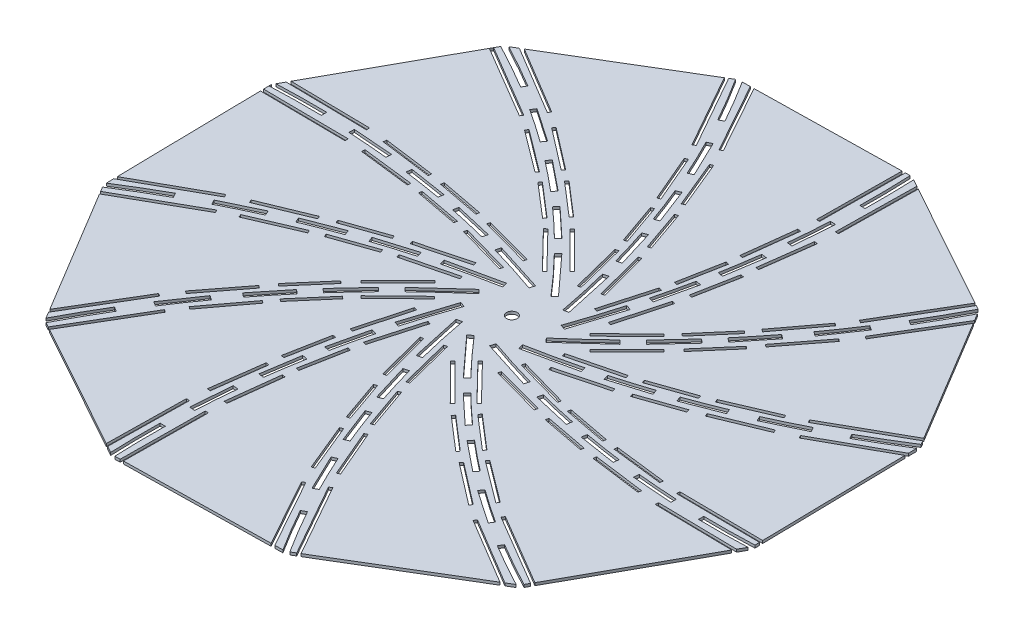
from build123d import *

# Parameters (mm, degrees)
BOSS_EXTRUDE2_DEPTH = 1.25
CUT_EXTRUDE1_DEPTH  = 10
CIRPATTERN3_DEPTH   = 1.25
CUT_EXTRUDE2_DEPTH  = 1.25
CIRPATTERN4_COUNT   = 12
SKETCH9_R           = 16.125
BOSS_EXTRUDE3_DEPTH = 1.25
BOSS_EXTRUDE4_DEPTH = 1.25
SKETCH13_R          = 2.5
CUT_EXTRUDE4_DEPTH  = 214.108875695


with BuildPart() as part:
    # Sketch2 → Boss-Extrude2 (new body)
    with BuildSketch(Plane(origin=(0, 0, 0), x_dir=(1, 0, 0), z_dir=(0, 1, 0))):
        with BuildLine():
            add(Edge.make_bspline(
                [(14.774632215, 2.590413659), (32.660535864, 51.583829136), (39.69013398, 100.241877456), (37.5, 150.695644658)],
                knots=[0, 0, 0, 0, 1, 1, 1, 1], degree=3))
            Line((37.5, 150.695644658), (107.823774971, 111.756256513))
            add(Edge.make_bspline(
                [(9.630680142, -11.5), (71.096415956, 41.392925852), (107.823774971, 111.756256513)],
                knots=[0, 0, 0, 1, 1, 1], degree=2))
            add(Edge.make_bspline(
                [(9.630680142, -11.5), (61.003174388, -2.492939191), (106.65707939, 15.748274422), (149.256256513, 42.871869687)],
                knots=[0, 0, 0, 0, 1, 1, 1, 1], degree=3))
            Line((149.256256513, 42.871869687), (150.695644658, -37.5))
            add(Edge.make_bspline(
                [(-5.143952072, -14.090413659), (71.395533302, -40.87483941), (150.695644658, -37.5)],
                knots=[0, 0, 0, 1, 1, 1], degree=2))
            add(Edge.make_bspline(
                [(-5.143952072, -14.090413659), (28.342638524, -54.076768327), (66.96694541, -84.493603035), (111.756256513, -107.823774971)],
                knots=[0, 0, 0, 0, 1, 1, 1, 1], degree=3))
            Line((111.756256513, -107.823774971), (42.871869687, -149.256256513))
            add(Edge.make_bspline(
                [(-14.774632215, -2.590413659), (0.299117346, -82.267765262), (42.871869687, -149.256256513)],
                knots=[0, 0, 0, 1, 1, 1], degree=2))
            add(Edge.make_bspline(
                [(-14.774632215, -2.590413659), (-32.660535864, -51.583829136), (-39.69013398, -100.241877456), (-37.5, -150.695644658)],
                knots=[0, 0, 0, 0, 1, 1, 1, 1], degree=3))
            Line((-37.5, -150.695644658), (-107.823774971, -111.756256513))
            add(Edge.make_bspline(
                [(-9.630680142, 11.5), (-71.096415956, -41.392925852), (-107.823774971, -111.756256513)],
                knots=[0, 0, 0, 1, 1, 1], degree=2))
            add(Edge.make_bspline(
                [(-9.630680142, 11.5), (-61.003174388, 2.492939191), (-106.65707939, -15.748274422), (-149.256256513, -42.871869687)],
                knots=[0, 0, 0, 0, 1, 1, 1, 1], degree=3))
            Line((-149.256256513, -42.871869687), (-150.695644658, 37.5))
            add(Edge.make_bspline(
                [(5.143952072, 14.090413659), (-71.395533302, 40.87483941), (-150.695644658, 37.5)],
                knots=[0, 0, 0, 1, 1, 1], degree=2))
            add(Edge.make_bspline(
                [(5.143952072, 14.090413659), (-28.342638524, 54.076768327), (-66.96694541, 84.493603035), (-111.756256513, 107.823774971)],
                knots=[0, 0, 0, 0, 1, 1, 1, 1], degree=3))
            Line((-111.756256513, 107.823774971), (-42.871869687, 149.256256513))
            add(Edge.make_bspline(
                [(14.774632215, 2.590413659), (-0.299117346, 82.267765262), (-42.871869687, 149.256256513)],
                knots=[0, 0, 0, 1, 1, 1], degree=2))
        make_face()
        with BuildLine():
            add(Edge.make_bspline(
                [(-5.143952072, -14.090413659), (71.395533302, -40.87483941), (150.695644658, -37.5)],
                knots=[0, 0, 0, 1, 1, 1], degree=2))
            Line((150.695644658, -37.5), (111.756256513, -107.823774971))
            add(Edge.make_bspline(
                [(-5.143952072, -14.090413659), (28.342638524, -54.076768327), (66.96694541, -84.493603035), (111.756256513, -107.823774971)],
                knots=[0, 0, 0, 0, 1, 1, 1, 1], degree=3))
        make_face()
        with BuildLine():
            add(Edge.make_bspline(
                [(-14.774632215, -2.590413659), (0.299117346, -82.267765262), (42.871869687, -149.256256513)],
                knots=[0, 0, 0, 1, 1, 1], degree=2))
            Line((42.871869687, -149.256256513), (-37.5, -150.695644658))
            add(Edge.make_bspline(
                [(-14.774632215, -2.590413659), (-32.660535864, -51.583829136), (-39.69013398, -100.241877456), (-37.5, -150.695644658)],
                knots=[0, 0, 0, 0, 1, 1, 1, 1], degree=3))
        make_face()
        with BuildLine():
            add(Edge.make_bspline(
                [(-9.630680142, 11.5), (-71.096415956, -41.392925852), (-107.823774971, -111.756256513)],
                knots=[0, 0, 0, 1, 1, 1], degree=2))
            Line((-107.823774971, -111.756256513), (-149.256256513, -42.871869687))
            add(Edge.make_bspline(
                [(-9.630680142, 11.5), (-61.003174388, 2.492939191), (-106.65707939, -15.748274422), (-149.256256513, -42.871869687)],
                knots=[0, 0, 0, 0, 1, 1, 1, 1], degree=3))
        make_face()
        with BuildLine():
            add(Edge.make_bspline(
                [(5.143952072, 14.090413659), (-71.395533302, 40.87483941), (-150.695644658, 37.5)],
                knots=[0, 0, 0, 1, 1, 1], degree=2))
            Line((-150.695644658, 37.5), (-111.756256513, 107.823774971))
            add(Edge.make_bspline(
                [(5.143952072, 14.090413659), (-28.342638524, 54.076768327), (-66.96694541, 84.493603035), (-111.756256513, 107.823774971)],
                knots=[0, 0, 0, 0, 1, 1, 1, 1], degree=3))
        make_face()
        with BuildLine():
            add(Edge.make_bspline(
                [(14.774632215, 2.590413659), (-0.299117346, 82.267765262), (-42.871869687, 149.256256513)],
                knots=[0, 0, 0, 1, 1, 1], degree=2))
            Line((-42.871869687, 149.256256513), (37.5, 150.695644658))
            add(Edge.make_bspline(
                [(14.774632215, 2.590413659), (32.660535864, 51.583829136), (39.69013398, 100.241877456), (37.5, 150.695644658)],
                knots=[0, 0, 0, 0, 1, 1, 1, 1], degree=3))
        make_face()
        with BuildLine():
            add(Edge.make_bspline(
                [(9.630680142, -11.5), (71.096415956, 41.392925852), (107.823774971, 111.756256513)],
                knots=[0, 0, 0, 1, 1, 1], degree=2))
            Line((107.823774971, 111.756256513), (149.256256513, 42.871869687))
            add(Edge.make_bspline(
                [(9.630680142, -11.5), (61.003174388, -2.492939191), (106.65707939, 15.748274422), (149.256256513, 42.871869687)],
                knots=[0, 0, 0, 0, 1, 1, 1, 1], degree=3))
        make_face()
    extrude(amount=BOSS_EXTRUDE2_DEPTH)

    # Sketch7 → Cut-Extrude1 (cut)
    with BuildSketch(Plane(origin=(0, 1.25, 0), x_dir=(1, 0, 0), z_dir=(0, 1, 0))):
        with BuildLine():
            add(Edge.make_bspline(
                [(-149.282481722, -41.407518955), (-149.228700939, -41.373413362), (-146.693873782, -39.766739974), (-141.381709294, -36.479286574), (-135.342424573, -32.928481348), (-131.09185765, -30.516169492), (-129.643105931, -29.705939951), (-128.938858403, -29.314905987)],
                knots=[-0.024102789, -0.024102789, -0.024102789, -0.024102789, -0.022844979, 0.035186849, 0.099507726, 0.116550339, 0.132630558, 0.132630558, 0.132630558, 0.132630558], degree=3))
            Line((-149.282481722, -41.407518955), (-149.256256513, -42.871869687))
            Line((-149.256256513, -42.871869687), (-148.612181694, -43.942688942))
            Line((-148.612181694, -43.942688942), (-148.584897413, -43.926278032))
            add(Edge.make_bspline(
                [(-148.584897413, -43.926278032), (-146.014006388, -42.28934952), (-140.93728059, -39.134741393), (-135.519091449, -35.93077168), (-132.077237941, -33.951986707), (-130.836208144, -33.245149502), (-129.593176427, -32.543854831), (-128.659834959, -32.020617091), (-128.036903141, -31.673621922), (-127.7252602, -31.500581947)],
                knots=[0.029007465, 0.029007465, 0.029007465, 0.029007465, 0.089694498, 0.147805056, 0.154966222, 0.169288553, 0.176449719, 0.183610885, 0.19077205, 0.19077205, 0.19077205, 0.19077205], degree=3))
            Line((-127.725260198, -31.50058195), (-128.938858403, -29.314905987))
        make_face()
        with BuildLine():
            Line((-11.053392377, 11.247936239), (-9.630680142, 11.5))
            add(Edge.make_bspline(
                [(-9.630680142, 11.5), (-10.105405181, 11.416767185), (-10.579641892, 11.332745837), (-11.053392376, 11.247936234)],
                knots=[0, 0, 0, 0, 0.009240841, 0.009240841, 0.009240841, 0.009240841], degree=3))
        make_face()
        with BuildLine():
            Line((-99.892572768, -14.748193021), (-117.065063259, -22.986708862))
            Line((-117.065063259, -22.986708862), (-115.927697313, -25.213005945))
            add(Edge.make_bspline(
                [(-115.927697313, -25.213005945), (-114.937296408, -24.707032026), (-112.027065207, -23.236248648), (-107.171906132, -20.860456384), (-102.467804444, -18.657451509), (-99.691802304, -17.398578089), (-98.868346085, -17.02875429)],
                knots=[0.280483128, 0.280483128, 0.280483128, 0.280483128, 0.302910897, 0.346262304, 0.389613711, 0.407854104, 0.407854104, 0.407854104, 0.407854104], degree=3))
            Line((-98.868346085, -17.02875429), (-99.892572768, -14.748193021))
        make_face()
        with BuildLine():
            Line((-38.501059144, 6.609925338), (-37.887193471, 4.186463159))
            add(Edge.make_bspline(
                [(-37.887193471, 4.186463159), (-37.180414885, 4.365490963), (-35.269718364, 4.843636439), (-30.352154167, 6.033876538), (-23.085593688, 7.663440839), (-16.931538829, 8.889415127), (-13.857159413, 9.464170353)],
                knots=[0.839804114, 0.839804114, 0.839804114, 0.839804114, 0.854186365, 0.878625933, 0.939312967, 1, 1, 1, 1], degree=3))
            Line((-13.857159413, 9.464170353), (-14.393713685, 11.907166411))
            Line((-14.393713685, 11.907166411), (-38.501059144, 6.609925338))
        make_face()
        with BuildLine():
            Line((-73.036719789, -3.919585165), (-89.87851656, -10.425078328))
            Line((-89.87851656, -10.425078328), (-88.921302479, -12.734567709))
            add(Edge.make_bspline(
                [(-88.921302479, -12.734567709), (-88.086830141, -12.388703961), (-86.415065458, -11.702974142), (-81.553962965, -9.750597285), (-76.812731203, -7.942684577), (-72.885202398, -6.521111908), (-72.192903694, -6.272875287)],
                knots=[0.480815674, 0.480815674, 0.480815674, 0.480815674, 0.499056067, 0.51729646, 0.586532476, 0.601322176, 0.601322176, 0.601322176, 0.601322176], degree=3))
            Line((-72.192903694, -6.272875287), (-73.036719789, -3.919585165))
        make_face()
        with BuildLine():
            Line((-64.724418608, -1.049643444), (-63.836814892, -3.389145732))
            add(Edge.make_bspline(
                [(-63.836814892, -3.389145732), (-63.136385097, -3.156766453), (-58.724063307, -1.707544494), (-53.581962331, -0.124972583), (-48.410000481, 1.361375644), (-47.015540641, 1.753394014), (-46.31726418, 1.947518211)],
                knots=[0.660480977, 0.660480977, 0.660480977, 0.660480977, 0.675270678, 0.753510604, 0.767892855, 0.782275107, 0.782275107, 0.782275107, 0.782275107], degree=3))
            Line((-46.31726418, 1.947518211), (-46.986880812, 4.356172102))
            Line((-46.986880812, 4.356172102), (-64.724418608, -1.049643444))
        make_face()
    extrude(amount=-CUT_EXTRUDE1_DEPTH, mode=Mode.SUBTRACT)

    # CirPattern3: read off the stored shape, not the designer's step
    # CirPattern3 outline → CirPattern3 (cut)
    with BuildSketch(Plane(origin=(0, 0, 0), x_dir=(1, 0, 0), z_dir=(0, 1, 0))):
        with BuildLine():
            add(Edge.make_bspline(
                [(-149.901339671, 38.934499302), (-149.859967869, 38.936213092), (-146.883678157, 39.059060746), (-140.661701424, 39.249317233), (-133.656124822, 39.304762402), (-128.768869958, 39.268602289), (-127.109099396, 39.245905795), (-126.303686163, 39.232427378)],
                knots=[-0.023662933, -0.023662933, -0.023662933, -0.023662933, -0.022844979, 0.035186849, 0.099507726, 0.116550339, 0.132630558, 0.132630558, 0.132630558, 0.132630558], degree=3))
            Line((-149.901339671, 38.934499302), (-150.675507762, 37.53636684))
            Line((-150.675507762, 37.53636684), (-150.655175387, 36.401057383))
            Line((-150.655175387, 36.401057383), (-150.623341053, 36.401627507))
            add(Edge.make_bspline(
                [(-150.623341053, 36.401627507), (-147.578419858, 36.533803671), (-141.604542285, 36.727411549), (-135.310267991, 36.793036143), (-131.340142931, 36.785787444), (-129.911960996, 36.777411521), (-128.484816617, 36.763234663), (-127.414900325, 36.749701104), (-126.701927961, 36.738741827), (-126.34551727, 36.732777371)],
                knots=[0.029007465, 0.029007465, 0.029007465, 0.029007465, 0.089694498, 0.147805056, 0.154966222, 0.169288553, 0.176449719, 0.183610885, 0.19077205, 0.19077205, 0.19077205, 0.19077205], degree=3))
            Line((-126.34551727, 36.732777371), (-126.303686163, 39.232427378))
        make_face()
        with BuildLine():
            add(Edge.make_bspline(
                [(-110.20897497, 108.75443164), (-107.611684073, 107.393881466), (-102.169300663, 104.469626713), (-96.079124524, 101.017436611), (-91.864717713, 98.542493603), (-90.438662489, 97.692952581), (-89.747893378, 97.278573313)],
                knots=[-0.022740828, -0.022740828, -0.022740828, -0.022740828, 0.035186849, 0.099507726, 0.116550339, 0.132630558, 0.132630558, 0.132630558, 0.132630558], degree=3))
            Line((-110.20897497, 108.75443164), (-111.756256513, 107.823774971))
            Line((-111.756256513, 107.823774971), (-112.220804569, 106.984810248))
            add(Edge.make_bspline(
                [(-112.220804569, 106.984810248), (-109.519057024, 105.577468339), (-104.250051688, 102.758872874), (-98.76751766, 99.669289448), (-95.332912851, 97.67794936), (-94.100258976, 96.956604631), (-92.871404117, 96.230754923), (-91.951596208, 95.684076371), (-91.339623667, 95.318099176), (-91.033945182, 95.13472846)],
                knots=[0.029036859, 0.029036859, 0.029036859, 0.029036859, 0.089694498, 0.147805056, 0.154966222, 0.169288553, 0.176449719, 0.183610885, 0.19077205, 0.19077205, 0.19077205, 0.19077205], degree=3))
            Line((-91.033945182, 95.13472846), (-89.747893378, 97.278573313))
        make_face()
        with BuildLine():
            add(Edge.make_bspline(
                [(-40.954471655, 149.290595393), (-39.417885171, 146.862665345), (-36.198827929, 141.658321039), (-32.680150564, 135.673680063), (-30.267838708, 131.42311314), (-29.457609167, 129.974361421), (-29.066575203, 129.270113893)],
                knots=[-0.021583724, -0.021583724, -0.021583724, -0.021583724, 0.035186849, 0.099507726, 0.116550339, 0.132630558, 0.132630558, 0.132630558, 0.132630558], degree=3))
            Line((-40.954471655, 149.290595393), (-42.871869687, 149.256256513))
            Line((-42.871869687, 149.256256513), (-43.611327618, 148.811488425))
            add(Edge.make_bspline(
                [(-43.611327618, 148.811488425), (-41.997292385, 146.274880981), (-38.865464717, 141.23311477), (-35.682440896, 135.850346939), (-33.703655923, 132.408493431), (-32.996818718, 131.167463634), (-32.295524047, 129.924431917), (-31.772286307, 128.991090449), (-31.425291138, 128.368158631), (-31.252251163, 128.05651569)],
                knots=[0.029830918, 0.029830918, 0.029830918, 0.029830918, 0.089694498, 0.147805056, 0.154966222, 0.169288553, 0.176449719, 0.183610885, 0.19077205, 0.19077205, 0.19077205, 0.19077205], degree=3))
            Line((-31.252251163, 128.05651569), (-29.066575203, 129.270113893))
        make_face()
        with BuildLine():
            add(Edge.make_bspline(
                [(39.20242207, 149.752986591), (39.315842557, 146.936887242), (39.498580056, 140.87519242), (39.553093186, 133.987380312), (39.516933073, 129.100125448), (39.494236579, 127.440354886), (39.480758162, 126.634941653)],
                knots=[-0.020501729, -0.020501729, -0.020501729, -0.020501729, 0.035186849, 0.099507726, 0.116550339, 0.132630558, 0.132630558, 0.132630558, 0.132630558], degree=3))
            Line((39.20242207, 149.752986591), (37.5, 150.695644658))
            Line((37.5, 150.695644658), (36.661760142, 150.680632533))
            add(Edge.make_bspline(
                [(36.661760142, 150.680632533), (36.788035651, 147.726645649), (36.976690537, 141.844852312), (37.041366927, 135.641523481), (37.034118228, 131.671398421), (37.025742305, 130.243216486), (37.011565447, 128.816072107), (36.998031888, 127.746155815), (36.987072611, 127.033183451), (36.981108155, 126.67677276)],
                knots=[0.030827433, 0.030827433, 0.030827433, 0.030827433, 0.089694498, 0.147805056, 0.154966222, 0.169288553, 0.176449719, 0.183610885, 0.19077205, 0.19077205, 0.19077205, 0.19077205], degree=3))
            Line((36.981108155, 126.67677276), (39.480758162, 126.634941653))
        make_face()
        with BuildLine():
            add(Edge.make_bspline(
                [(108.794271154, 110.142739003), (107.500723913, 107.67978486), (104.64469178, 102.371304545), (101.265767395, 96.410380014), (98.790824387, 92.195973203), (97.941283365, 90.769917979), (97.526904097, 90.079148868)],
                knots=[-0.019784656, -0.019784656, -0.019784656, -0.019784656, 0.035186849, 0.099507726, 0.116550339, 0.132630558, 0.132630558, 0.132630558, 0.132630558], degree=3))
            Line((108.794271154, 110.142739003), (107.823774971, 111.756256513))
            Line((107.823774971, 111.756256513), (107.043448438, 112.188335675))
            add(Edge.make_bspline(
                [(107.043448438, 112.188335675), (105.696527892, 109.608801637), (102.940408656, 104.462777972), (99.917620232, 99.09877315), (97.926280144, 95.664168341), (97.204935415, 94.431514466), (96.479085707, 93.202659607), (95.932407155, 92.282851698), (95.56642996, 91.670879157), (95.383059244, 91.365200672)],
                knots=[0.031759379, 0.031759379, 0.031759379, 0.031759379, 0.089694498, 0.147805056, 0.154966222, 0.169288553, 0.176449719, 0.183610885, 0.19077205, 0.19077205, 0.19077205, 0.19077205], degree=3))
            Line((95.383059244, 91.365200672), (97.526904097, 90.079148868))
        make_face()
        with BuildLine():
            Line((-107.823774971, -111.756256513), (-106.627309107, -112.418758615))
            add(Edge.make_bspline(
                [(-106.627309107, -112.418758615), (-105.228317252, -109.733937053), (-102.418367566, -104.481968465), (-99.338033958, -99.015848444), (-97.34669387, -95.581243635), (-96.625349141, -94.34858976), (-95.899499433, -93.119734901), (-95.352820881, -92.199926992), (-94.986843686, -91.587954451), (-94.80347297, -91.282275966)],
                knots=[0.029413875, 0.029413875, 0.029413875, 0.029413875, 0.089694498, 0.147805056, 0.154966222, 0.169288553, 0.176449719, 0.183610885, 0.19077205, 0.19077205, 0.19077205, 0.19077205], degree=3))
            Line((-94.80347297, -91.282275966), (-96.947317823, -89.996224162))
            add(Edge.make_bspline(
                [(-108.507822072, -110.618980556), (-108.48205918, -110.569746988), (-107.093862164, -107.918151553), (-104.140952497, -102.422185198), (-100.686181121, -96.327455308), (-98.211238113, -92.113048497), (-97.361697091, -90.686993273), (-96.947317823, -89.996224162)],
                knots=[-0.023942544, -0.023942544, -0.023942544, -0.023942544, -0.022844979, 0.035186849, 0.099507726, 0.116550339, 0.132630558, 0.132630558, 0.132630558, 0.132630558], degree=3))
            Line((-108.507822072, -110.618980556), (-107.823774971, -111.756256513))
        make_face()
        with BuildLine():
            Line((-37.5, -150.695644658), (-36.079068794, -150.670197053))
            add(Edge.make_bspline(
                [(-36.079068794, -150.670197053), (-36.206894044, -147.692145505), (-36.396853386, -141.785990093), (-36.461780653, -135.558598775), (-36.454531954, -131.588473715), (-36.446156031, -130.16029178), (-36.431979173, -128.733147401), (-36.418445614, -127.663231109), (-36.407486337, -126.950258745), (-36.401521881, -126.593848054)],
                knots=[0.030345903, 0.030345903, 0.030345903, 0.030345903, 0.089694498, 0.147805056, 0.154966222, 0.169288553, 0.176449719, 0.183610885, 0.19077205, 0.19077205, 0.19077205, 0.19077205], degree=3))
            Line((-36.401521881, -126.593848054), (-38.901171888, -126.552016947))
            add(Edge.make_bspline(
                [(-38.605990337, -150.083240289), (-38.606783685, -150.064014591), (-38.728481527, -147.10989276), (-38.918061743, -140.910032208), (-38.973506912, -133.904455606), (-38.937346799, -129.017200742), (-38.914650305, -127.35743018), (-38.901171888, -126.552016947)],
                knots=[-0.02322512, -0.02322512, -0.02322512, -0.02322512, -0.022844979, 0.035186849, 0.099507726, 0.116550339, 0.132630558, 0.132630558, 0.132630558, 0.132630558], degree=3))
            Line((-38.605990337, -150.083240289), (-37.5, -150.695644658))
        make_face()
        with BuildLine():
            Line((42.871869687, -149.256256513), (44.068705463, -148.536385458))
            add(Edge.make_bspline(
                [(44.068705463, -148.536385458), (42.496651086, -146.062762068), (39.406604297, -141.085173388), (36.26202717, -135.767422233), (34.283242197, -132.325568725), (33.576404993, -131.084538928), (32.875110321, -129.841507211), (32.351872581, -128.908165743), (32.004877412, -128.285233925), (31.831837437, -127.973590984)],
                knots=[0.031342386, 0.031342386, 0.031342386, 0.031342386, 0.089694498, 0.147805056, 0.154966222, 0.169288553, 0.176449719, 0.183610885, 0.19077205, 0.19077205, 0.19077205, 0.19077205], degree=3))
            Line((31.831837437, -127.973590984), (29.646161477, -129.187189187))
            add(Edge.make_bspline(
                [(41.57946557, -149.279402313), (40.027200752, -146.827799351), (36.792656379, -141.599619727), (33.259736838, -135.590755357), (30.847424982, -131.340188434), (30.037195442, -129.891436715), (29.646161477, -129.187189187)],
                knots=[-0.022142834, -0.022142834, -0.022142834, -0.022142834, 0.035186849, 0.099507726, 0.116550339, 0.132630558, 0.132630558, 0.132630558, 0.132630558], degree=3))
            Line((41.57946557, -149.279402313), (42.871869687, -149.256256513))
        make_face()
        with BuildLine():
            Line((111.756256513, -107.823774971), (112.386316897, -106.685898215))
            add(Edge.make_bspline(
                [(112.386316897, -106.685898215), (109.823701643, -105.347365979), (104.694697537, -102.599904919), (99.347103934, -99.586364742), (95.912499125, -97.595024654), (94.67984525, -96.873679925), (93.450990391, -96.147830217), (92.531182482, -95.601151665), (91.919209941, -95.23517447), (91.613531457, -95.051803754)],
                knots=[0.032136331, 0.032136331, 0.032136331, 0.032136331, 0.089694498, 0.147805056, 0.154966222, 0.169288553, 0.176449719, 0.183610885, 0.19077205, 0.19077205, 0.19077205, 0.19077205], degree=3))
            Line((91.613531457, -95.051803754), (90.327479652, -97.195648607))
            add(Edge.make_bspline(
                [(110.552548402, -108.547779588), (108.035030079, -107.226974546), (102.672154389, -104.343206493), (96.658710798, -100.934511905), (92.444303987, -98.459568897), (91.018248763, -97.610027875), (90.327479652, -97.195648607)],
                knots=[-0.020985844, -0.020985844, -0.020985844, -0.020985844, 0.035186849, 0.099507726, 0.116550339, 0.132630558, 0.132630558, 0.132630558, 0.132630558], degree=3))
            Line((110.552548402, -108.547779588), (111.756256513, -107.823774971))
        make_face()
        with BuildLine():
            Line((150.695644658, -37.5), (150.674893157, -36.341287612))
            add(Edge.make_bspline(
                [(150.674893157, -36.341287612), (147.805273451, -36.462196941), (142.008851727, -36.646314293), (135.889854265, -36.710111437), (131.919729205, -36.702862738), (130.491547271, -36.694486815), (129.064402891, -36.680309957), (127.994486599, -36.666776398), (127.281514235, -36.655817121), (126.925103544, -36.649852665)],
                knots=[0.032515042, 0.032515042, 0.032515042, 0.032515042, 0.089694498, 0.147805056, 0.154966222, 0.169288553, 0.176449719, 0.183610885, 0.19077205, 0.19077205, 0.19077205, 0.19077205], degree=3))
            Line((126.925103544, -36.649852665), (126.883272437, -39.149502672))
            add(Edge.make_bspline(
                [(149.934930409, -38.873835085), (147.141011303, -38.985917952), (141.101530462, -39.167498626), (134.235711096, -39.221837696), (129.348456232, -39.185677583), (127.68868567, -39.162981089), (126.883272437, -39.149502672)],
                knots=[-0.020064123, -0.020064123, -0.020064123, -0.020064123, 0.035186849, 0.099507726, 0.116550339, 0.132630558, 0.132630558, 0.132630558, 0.132630558], degree=3))
            Line((149.934930409, -38.873835085), (150.695644658, -37.5))
        make_face()
        with BuildLine():
            add(Edge.make_bspline(
                [(149.287510287, 41.126736341), (146.94257538, 39.645008918), (141.82176856, 36.480176195), (135.922010847, 33.011406054), (131.671443924, 30.599094198), (130.222692205, 29.788864657), (129.518444677, 29.397830693)],
                knots=[-0.019624497, -0.019624497, -0.019624497, -0.019624497, 0.035186849, 0.099507726, 0.116550339, 0.132630558, 0.132630558, 0.132630558, 0.132630558], degree=3))
            Line((149.287510287, 41.126736341), (149.256256513, 42.871869687))
            Line((149.256256513, 42.871869687), (148.736036731, 43.736771315))
            add(Edge.make_bspline(
                [(148.736036731, 43.736771315), (146.30557054, 42.193424756), (141.371921267, 39.131954565), (136.098677724, 36.013696386), (132.656824216, 34.034911413), (131.415794418, 33.328074208), (130.172762702, 32.626779537), (129.239421233, 32.103541797), (128.616489415, 31.756546628), (128.304846474, 31.583506653)],
                knots=[0.032377072, 0.032377072, 0.032377072, 0.032377072, 0.089694498, 0.147805056, 0.154966222, 0.169288553, 0.176449719, 0.183610885, 0.19077205, 0.19077205, 0.19077205, 0.19077205], degree=3))
            Line((128.304846474, 31.583506653), (129.518444677, 29.397830693))
        make_face()
        with BuildLine():
            Line((-3.930456737, 15.418146177), (-2.572319917, 14.925083685))
            add(Edge.make_bspline(
                [(-2.572319917, 14.925083685), (-3.025060268, 15.090364473), (-3.477771981, 15.254718206), (-3.930456737, 15.418146177)],
                knots=[0, 0, 0, 0, 0.009240841, 0.009240841, 0.009240841, 0.009240841], degree=3))
        make_face()
        with BuildLine():
            Line((33.741824348, -55.716943727), (35.324090904, -53.778505216))
            add(Edge.make_bspline(
                [(35.324090904, -53.778505216), (34.772629648, -53.288104859), (31.31140572, -50.191533079), (27.369807754, -46.529628961), (23.496611505, -42.793752725), (22.459883718, -41.782124264), (21.942629002, -41.274461208)],
                knots=[0.660480977, 0.660480977, 0.660480977, 0.660480977, 0.675270678, 0.753510604, 0.767892855, 0.782275107, 0.782275107, 0.782275107, 0.782275107], degree=3))
            Line((21.942629002, -41.274461208), (20.191481859, -43.058693167))
            Line((20.191481859, -43.058693167), (33.741824348, -55.716943727))
        make_face()
        with BuildLine():
            Line((13.996763468, -36.836632649), (15.788610445, -35.093278293))
            add(Edge.make_bspline(
                [(15.788610445, -35.093278293), (15.280178526, -34.570703984), (13.910744136, -33.155064996), (10.421183875, -29.491449526), (5.376659553, -24.013205704), (1.237907246, -19.296625003), (-0.797035089, -16.921511941)],
                knots=[0.839804114, 0.839804114, 0.839804114, 0.839804114, 0.854186365, 0.878625933, 0.939312967, 1, 1, 1, 1], degree=3))
            Line((-0.797035089, -16.921511941), (-2.6444546, -18.6076796))
            Line((-2.6444546, -18.6076796), (13.996763468, -36.836632649))
        make_face()
        with BuildLine():
            Line((-3.743705174, -15.385261402), (-4.673354916, -14.279188348))
            add(Edge.make_bspline(
                [(-4.673354916, -14.279188348), (-4.363910664, -14.648695884), (-4.054027687, -15.017386249), (-3.743705174, -15.385261402)],
                knots=[0, 0, 0, 0, 0.009240841, 0.009240841, 0.009240841, 0.009240841], degree=3))
        make_face()
        with BuildLine():
            Line((-10.916680744, -11.30172316), (-11.16874451, -9.879010926))
            add(Edge.make_bspline(
                [(-11.16874451, -9.879010926), (-11.085511695, -10.353735965), (-11.001490347, -10.827972676), (-10.916680744, -11.30172316)],
                knots=[0, 0, 0, 0, 0.009240841, 0.009240841, 0.009240841, 0.009240841], degree=3))
        make_face()
        with BuildLine():
            Line((78.91020261, -90.076738936), (80.269549467, -87.978602591))
            add(Edge.make_bspline(
                [(80.269549467, -87.978602591), (79.336162747, -87.373877208), (76.607311378, -85.588934746), (72.122235386, -82.572139779), (67.862326355, -79.599770654), (65.384108923, -77.825118989), (64.652104009, -77.296896884)],
                knots=[0.280483128, 0.280483128, 0.280483128, 0.280483128, 0.302910897, 0.346262304, 0.389613711, 0.407854104, 0.407854104, 0.407854104, 0.407854104], degree=3))
            Line((64.652104009, -77.296896884), (63.189193357, -79.324183845))
            Line((63.189193357, -79.324183845), (78.91020261, -90.076738936))
        make_face()
        with BuildLine():
            Line((54.438238105, -72.81331412), (55.959707539, -70.829597719))
            add(Edge.make_bspline(
                [(55.959707539, -70.829597719), (55.242944577, -70.27985535), (53.813202792, -69.174929575), (49.69184359, -65.941279753), (45.755529376, -62.739208956), (42.560646929, -60.048655572), (41.999518357, -59.573225618)],
                knots=[0.480815674, 0.480815674, 0.480815674, 0.480815674, 0.499056067, 0.51729646, 0.586532476, 0.601322176, 0.601322176, 0.601322176, 0.601322176], degree=3))
            Line((41.999518357, -59.573225618), (40.383417377, -61.480636853))
            Line((40.383417377, -61.480636853), (54.438238105, -72.81331412))
        make_face()
        with BuildLine():
            Line((4.510043011, -15.335221471), (3.151906191, -14.842158979))
            add(Edge.make_bspline(
                [(3.151906191, -14.842158979), (3.604646542, -15.007439767), (4.057358255, -15.1717935), (4.510043011, -15.335221471)],
                knots=[0, 0, 0, 0, 0.009240841, 0.009240841, 0.009240841, 0.009240841], degree=3))
        make_face()
        with BuildLine():
            Line((117.644649533, 23.069633568), (116.507283587, 25.295930651))
            add(Edge.make_bspline(
                [(116.507283587, 25.295930651), (115.516882682, 24.789956732), (112.606651481, 23.319173354), (107.751492406, 20.94338109), (103.047390719, 18.740376215), (100.271388578, 17.481502795), (99.447932359, 17.111678996)],
                knots=[0.280483128, 0.280483128, 0.280483128, 0.280483128, 0.302910897, 0.346262304, 0.389613711, 0.407854104, 0.407854104, 0.407854104, 0.407854104], degree=3))
            Line((99.447932359, 17.111678996), (100.472159042, 14.831117727))
            Line((100.472159042, 14.831117727), (117.644649533, 23.069633568))
        make_face()
        with BuildLine():
            Line((90.458102834, 10.508003034), (89.500888753, 12.817492415))
            add(Edge.make_bspline(
                [(89.500888753, 12.817492415), (88.666416415, 12.471628667), (86.994651733, 11.785898848), (82.133549239, 9.833521991), (77.392317477, 8.025609283), (73.464788673, 6.604036614), (72.772489968, 6.355799993)],
                knots=[0.480815674, 0.480815674, 0.480815674, 0.480815674, 0.499056067, 0.51729646, 0.586532476, 0.601322176, 0.601322176, 0.601322176, 0.601322176], degree=3))
            Line((72.772489968, 6.355799993), (73.616306063, 4.002509871))
            Line((73.616306063, 4.002509871), (90.458102834, 10.508003034))
        make_face()
        with BuildLine():
            Line((30.599425154, -25.042419597), (31.279532977, -22.636706948))
            add(Edge.make_bspline(
                [(31.279532977, -22.636706948), (30.577930865, -22.438360281), (28.684146401, -21.897098149), (23.830290832, -20.469094213), (16.722482707, -18.247058056), (10.779927719, -16.231755504), (7.830059431, -15.192318422)],
                knots=[0.839804114, 0.839804114, 0.839804114, 0.839804114, 0.854186365, 0.878625933, 0.939312967, 1, 1, 1, 1], degree=3))
            Line((7.830059431, -15.192318422), (7.073231032, -17.576292206))
            Line((7.073231032, -17.576292206), (30.599425154, -25.042419597))
        make_face()
        with BuildLine():
            Line((57.139305014, -31.520718181), (57.540368792, -29.05084791))
            add(Edge.make_bspline(
                [(57.540368792, -29.05084791), (56.817589156, -28.901879371), (52.271795417, -27.950781508), (47.027319387, -26.750278498), (41.805094924, -25.451512897), (40.401448093, -25.093780844), (39.69966084, -24.912759099)],
                knots=[0.660480977, 0.660480977, 0.660480977, 0.660480977, 0.675270678, 0.753510604, 0.767892855, 0.782275107, 0.782275107, 0.782275107, 0.782275107], degree=3))
            Line((39.69966084, -24.912759099), (39.075238909, -27.333522874))
            Line((39.075238909, -27.333522874), (57.139305014, -31.520718181))
        make_face()
        with BuildLine():
            Line((83.611110291, -35.978402376), (83.936883271, -33.499718862))
            add(Edge.make_bspline(
                [(83.936883271, -33.499718862), (83.041277153, -33.382009485), (81.25062156, -33.139986587), (76.064594881, -32.400243296), (71.054611376, -31.595325748), (66.942485323, -30.86267939), (66.218818748, -30.731509258)],
                knots=[0.480815674, 0.480815674, 0.480815674, 0.480815674, 0.499056067, 0.51729646, 0.586532476, 0.601322176, 0.601322176, 0.601322176, 0.601322176], degree=3))
            Line((66.218818748, -30.731509258), (65.772939861, -33.191426334))
            Line((65.772939861, -33.191426334), (83.611110291, -35.978402376))
        make_face()
        with BuildLine():
            Line((113.436165641, -38.69298457), (113.56432638, -36.196271766))
            add(Edge.make_bspline(
                [(113.56432638, -36.196271766), (112.453627077, -36.139257582), (109.197901237, -35.957877751), (103.805314007, -35.587794667), (98.629940005, -35.14360201), (95.596414921, -34.845817302), (94.698369017, -34.754365997)],
                knots=[0.280483128, 0.280483128, 0.280483128, 0.280483128, 0.302910897, 0.346262304, 0.389613711, 0.407854104, 0.407854104, 0.407854104, 0.407854104], degree=3))
            Line((94.698369017, -34.754365997), (94.445094709, -37.241503332))
            Line((94.445094709, -37.241503332), (113.436165641, -38.69298457))
        make_face()
        with BuildLine():
            Line((-15.136930618, 4.074960664), (-14.030857564, 5.004610406))
            add(Edge.make_bspline(
                [(-14.030857564, 5.004610406), (-14.4003651, 4.695166154), (-14.769055465, 4.385283177), (-15.136930618, 4.074960664)],
                knots=[0, 0, 0, 0, 0.009240841, 0.009240841, 0.009240841, 0.009240841], degree=3))
        make_face()
        with BuildLine():
            Line((-38.444653786, -113.104910151), (-35.947940982, -113.23307089))
            add(Edge.make_bspline(
                [(-35.947940982, -113.23307089), (-35.890926798, -112.122371586), (-35.709546967, -108.866645746), (-35.339463883, -103.474058516), (-34.895271226, -98.298684515), (-34.597486518, -95.265159431), (-34.506035213, -94.367113526)],
                knots=[0.280483128, 0.280483128, 0.280483128, 0.280483128, 0.302910897, 0.346262304, 0.389613711, 0.407854104, 0.407854104, 0.407854104, 0.407854104], degree=3))
            Line((-34.506035213, -94.367113526), (-36.993172548, -94.113839219))
            Line((-36.993172548, -94.113839219), (-38.444653786, -113.104910151))
        make_face()
        with BuildLine():
            Line((-35.730071592, -83.279854801), (-33.251388078, -83.605627781))
            add(Edge.make_bspline(
                [(-33.251388078, -83.605627781), (-33.133678701, -82.710021663), (-32.891655803, -80.91936607), (-32.151912511, -75.733339391), (-31.346994964, -70.723355886), (-30.614348606, -66.611229833), (-30.483178474, -65.887563258)],
                knots=[0.480815674, 0.480815674, 0.480815674, 0.480815674, 0.499056067, 0.51729646, 0.586532476, 0.601322176, 0.601322176, 0.601322176, 0.601322176], degree=3))
            Line((-30.483178474, -65.887563258), (-32.94309555, -65.441684371))
            Line((-32.94309555, -65.441684371), (-35.730071592, -83.279854801))
        make_face()
        with BuildLine():
            Line((-36.588301865, -13.665507978), (-34.844947508, -15.457354954))
            add(Edge.make_bspline(
                [(-34.844947508, -15.457354954), (-34.3223732, -14.948923035), (-32.906734212, -13.579488646), (-29.243118742, -10.089928385), (-23.76487492, -5.045404063), (-19.048294219, -0.906651756), (-16.673181157, 1.128290579)],
                knots=[0.839804114, 0.839804114, 0.839804114, 0.839804114, 0.854186365, 0.878625933, 0.939312967, 1, 1, 1, 1], degree=3))
            Line((-16.673181157, 1.128290579), (-18.359348816, 2.97571009))
            Line((-18.359348816, 2.97571009), (-36.588301865, -13.665507978))
        make_face()
        with BuildLine():
            Line((-55.468612943, -33.410568858), (-53.530174432, -34.992835414))
            add(Edge.make_bspline(
                [(-53.530174432, -34.992835414), (-53.039774075, -34.441374157), (-49.943202295, -30.98015023), (-46.281298177, -27.038552264), (-42.545421941, -23.165356015), (-41.53379348, -22.128628228), (-41.026130424, -21.611373512)],
                knots=[0.660480977, 0.660480977, 0.660480977, 0.660480977, 0.675270678, 0.753510604, 0.767892855, 0.782275107, 0.782275107, 0.782275107, 0.782275107], degree=3))
            Line((-41.026130424, -21.611373512), (-42.810362383, -19.860226369))
            Line((-42.810362383, -19.860226369), (-55.468612943, -33.410568858))
        make_face()
        with BuildLine():
            Line((-72.564983336, -54.106982614), (-70.581266935, -55.628452049))
            add(Edge.make_bspline(
                [(-70.581266935, -55.628452049), (-70.031524566, -54.911689087), (-68.926598791, -53.481947302), (-65.692948969, -49.3605881), (-62.490878172, -45.424273886), (-59.800324788, -42.229391439), (-59.324894834, -41.668262867)],
                knots=[0.480815674, 0.480815674, 0.480815674, 0.480815674, 0.499056067, 0.51729646, 0.586532476, 0.601322176, 0.601322176, 0.601322176, 0.601322176], degree=3))
            Line((-59.324894834, -41.668262867), (-61.232306069, -40.052161886))
            Line((-61.232306069, -40.052161886), (-72.564983336, -54.106982614))
        make_face()
        with BuildLine():
            Line((-89.828408152, -78.578947119), (-87.730271807, -79.938293977))
            add(Edge.make_bspline(
                [(-87.730271807, -79.938293977), (-87.125546424, -79.004907257), (-85.340603962, -76.276055887), (-82.323808995, -71.790979896), (-79.35143987, -67.531070865), (-77.576788205, -65.052853433), (-77.0485661, -64.320848519)],
                knots=[0.280483128, 0.280483128, 0.280483128, 0.280483128, 0.302910897, 0.346262304, 0.389613711, 0.407854104, 0.407854104, 0.407854104, 0.407854104], degree=3))
            Line((-77.0485661, -64.320848519), (-79.075853061, -62.857937867))
            Line((-79.075853061, -62.857937867), (-89.828408152, -78.578947119))
        make_face()
        with BuildLine():
            Line((-6.278669848, -38.749389928), (-3.855207669, -38.135524255))
            add(Edge.make_bspline(
                [(-3.855207669, -38.135524255), (-4.034235473, -37.428745669), (-4.512380949, -35.518049148), (-5.702621047, -30.600484951), (-7.332185349, -23.333924472), (-8.558159637, -17.179869613), (-9.132914863, -14.105490197)],
                knots=[0.839804114, 0.839804114, 0.839804114, 0.839804114, 0.854186365, 0.878625933, 0.939312967, 1, 1, 1, 1], degree=3))
            Line((-9.132914863, -14.105490197), (-11.575910921, -14.642044469))
            Line((-11.575910921, -14.642044469), (-6.278669848, -38.749389928))
        make_face()
        with BuildLine():
            Line((1.380898934, -64.972749392), (3.720401222, -64.085145676))
            add(Edge.make_bspline(
                [(3.720401222, -64.085145676), (3.488021943, -63.384715881), (2.038799984, -58.972394091), (0.456228073, -53.830293115), (-1.030120154, -48.658331265), (-1.422138524, -47.263871425), (-1.616262721, -46.565594964)],
                knots=[0.660480977, 0.660480977, 0.660480977, 0.660480977, 0.675270678, 0.753510604, 0.767892855, 0.782275107, 0.782275107, 0.782275107, 0.782275107], degree=3))
            Line((-1.616262721, -46.565594964), (-4.024916612, -47.235211596))
            Line((-4.024916612, -47.235211596), (1.380898934, -64.972749392))
        make_face()
        with BuildLine():
            Line((10.756333818, -90.126847344), (13.065823199, -89.169633263))
            add(Edge.make_bspline(
                [(13.065823199, -89.169633263), (12.719959451, -88.335160925), (12.034229632, -86.663396242), (10.081852776, -81.802293749), (8.273940067, -77.061061987), (6.852367399, -73.133533183), (6.604130777, -72.441234478)],
                knots=[0.480815674, 0.480815674, 0.480815674, 0.480815674, 0.499056067, 0.51729646, 0.586532476, 0.601322176, 0.601322176, 0.601322176, 0.601322176], degree=3))
            Line((6.604130777, -72.441234478), (4.250840655, -73.285050573))
            Line((4.250840655, -73.285050573), (10.756333818, -90.126847344))
        make_face()
        with BuildLine():
            Line((23.317964352, -117.313394043), (25.544261435, -116.176028097))
            add(Edge.make_bspline(
                [(25.544261435, -116.176028097), (25.038287516, -115.185627192), (23.567504138, -112.275395991), (21.191711874, -107.420236916), (18.988706999, -102.716135228), (17.729833579, -99.940133088), (17.36000978, -99.116676869)],
                knots=[0.280483128, 0.280483128, 0.280483128, 0.280483128, 0.302910897, 0.346262304, 0.389613711, 0.407854104, 0.407854104, 0.407854104, 0.407854104], degree=3))
            Line((17.36000978, -99.116676869), (15.079448511, -100.140903552))
            Line((15.079448511, -100.140903552), (23.317964352, -117.313394043))
        make_face()
        with BuildLine():
            Line((-31.272387397, -56.808049524), (-28.802517125, -57.209113301))
            add(Edge.make_bspline(
                [(-28.802517125, -57.209113301), (-28.653548586, -56.486333666), (-27.702450724, -51.940539927), (-26.501947714, -46.696063897), (-25.203182113, -41.473839434), (-24.84545006, -40.070192603), (-24.664428315, -39.36840535)],
                knots=[0.660480977, 0.660480977, 0.660480977, 0.660480977, 0.675270678, 0.753510604, 0.767892855, 0.782275107, 0.782275107, 0.782275107, 0.782275107], degree=3))
            Line((-24.664428315, -39.36840535), (-27.08519209, -38.743983419))
            Line((-27.08519209, -38.743983419), (-31.272387397, -56.808049524))
        make_face()
        with BuildLine():
            Line((-24.794088813, -30.268169664), (-22.388376164, -30.948277487))
            add(Edge.make_bspline(
                [(-22.388376164, -30.948277487), (-22.190029497, -30.246675374), (-21.648767365, -28.352890911), (-20.220763429, -23.499035342), (-17.998727272, -16.391227217), (-15.98342472, -10.448672229), (-14.943987638, -7.498803941)],
                knots=[0.839804114, 0.839804114, 0.839804114, 0.839804114, 0.854186365, 0.878625933, 0.939312967, 1, 1, 1, 1], degree=3))
            Line((-14.943987638, -7.498803941), (-17.327961422, -6.741975542))
            Line((-17.327961422, -6.741975542), (-24.794088813, -30.268169664))
        make_face()
        with BuildLine():
            Line((-15.086890687, -4.178787521), (-14.593828195, -2.820650701))
            add(Edge.make_bspline(
                [(-14.593828195, -2.820650701), (-14.759108983, -3.273391052), (-14.923462716, -3.726102765), (-15.086890687, -4.178787521)],
                knots=[0, 0, 0, 0, 0.009240841, 0.009240841, 0.009240841, 0.009240841], degree=3))
        make_face()
        with BuildLine():
            Line((11.496267018, 11.384647866), (11.748330784, 9.961935632))
            add(Edge.make_bspline(
                [(11.748330784, 9.961935632), (11.665097969, 10.436660671), (11.581076621, 10.910897382), (11.496267018, 11.384647866)],
                knots=[0, 0, 0, 0, 0.009240841, 0.009240841, 0.009240841, 0.009240841], degree=3))
        make_face()
        with BuildLine():
            Line((-78.330616335, 90.159663642), (-79.689963193, 88.061527297))
            add(Edge.make_bspline(
                [(-79.689963193, 88.061527297), (-78.756576473, 87.456801914), (-76.027725103, 85.671859452), (-71.542649112, 82.655064485), (-67.282740081, 79.68269536), (-64.804522649, 77.908043695), (-64.072517735, 77.37982159)],
                knots=[0.280483128, 0.280483128, 0.280483128, 0.280483128, 0.302910897, 0.346262304, 0.389613711, 0.407854104, 0.407854104, 0.407854104, 0.407854104], degree=3))
            Line((-64.072517735, 77.37982159), (-62.609607082, 79.407108551))
            Line((-62.609607082, 79.407108551), (-78.330616335, 90.159663642))
        make_face()
        with BuildLine():
            Line((-53.85865183, 72.896238826), (-55.380121265, 70.912522425))
            add(Edge.make_bspline(
                [(-55.380121265, 70.912522425), (-54.663358303, 70.362780056), (-53.233616518, 69.257854281), (-49.112257316, 66.024204459), (-45.175943102, 62.822133662), (-41.981060655, 60.131580278), (-41.419932083, 59.656150324)],
                knots=[0.480815674, 0.480815674, 0.480815674, 0.480815674, 0.499056067, 0.51729646, 0.586532476, 0.601322176, 0.601322176, 0.601322176, 0.601322176], degree=3))
            Line((-41.419932083, 59.656150324), (-39.803831102, 61.563561559))
            Line((-39.803831102, 61.563561559), (-53.85865183, 72.896238826))
        make_face()
        with BuildLine():
            Line((6.858256123, 38.832314634), (4.434793943, 38.218448961))
            add(Edge.make_bspline(
                [(4.434793943, 38.218448961), (4.613821747, 37.511670375), (5.091967223, 35.600973854), (6.282207322, 30.683409657), (7.911771623, 23.416849178), (9.137745911, 17.262794319), (9.712501137, 14.188414903)],
                knots=[0.839804114, 0.839804114, 0.839804114, 0.839804114, 0.854186365, 0.878625933, 0.939312967, 1, 1, 1, 1], degree=3))
            Line((9.712501137, 14.188414903), (12.155497195, 14.724969175))
            Line((12.155497195, 14.724969175), (6.858256123, 38.832314634))
        make_face()
        with BuildLine():
            Line((-0.80131266, 65.055674098), (-3.140814948, 64.168070382))
            add(Edge.make_bspline(
                [(-3.140814948, 64.168070382), (-2.908435669, 63.467640587), (-1.45921371, 59.055318797), (0.123358201, 53.913217821), (1.609706428, 48.741255971), (2.001724798, 47.346796131), (2.195848995, 46.64851967)],
                knots=[0.660480977, 0.660480977, 0.660480977, 0.660480977, 0.675270678, 0.753510604, 0.767892855, 0.782275107, 0.782275107, 0.782275107, 0.782275107], degree=3))
            Line((2.195848995, 46.64851967), (4.604502886, 47.318136302))
            Line((4.604502886, 47.318136302), (-0.80131266, 65.055674098))
        make_face()
        with BuildLine():
            Line((-10.176747543, 90.20977205), (-12.486236925, 89.252557969))
            add(Edge.make_bspline(
                [(-12.486236925, 89.252557969), (-12.140373177, 88.418085631), (-11.454643358, 86.746320949), (-9.502266501, 81.885218455), (-7.694353793, 77.143986693), (-6.272781124, 73.216457889), (-6.024544503, 72.524159184)],
                knots=[0.480815674, 0.480815674, 0.480815674, 0.480815674, 0.499056067, 0.51729646, 0.586532476, 0.601322176, 0.601322176, 0.601322176, 0.601322176], degree=3))
            Line((-6.024544503, 72.524159184), (-3.671254381, 73.367975279))
            Line((-3.671254381, 73.367975279), (-10.176747543, 90.20977205))
        make_face()
        with BuildLine():
            Line((-22.738378078, 117.396318749), (-24.964675161, 116.258952803))
            add(Edge.make_bspline(
                [(-24.964675161, 116.258952803), (-24.458701242, 115.268551898), (-22.987917863, 112.358320697), (-20.6121256, 107.503161622), (-18.409120725, 102.799059935), (-17.150247305, 100.023057794), (-16.780423506, 99.199601575)],
                knots=[0.280483128, 0.280483128, 0.280483128, 0.280483128, 0.302910897, 0.346262304, 0.389613711, 0.407854104, 0.407854104, 0.407854104, 0.407854104], degree=3))
            Line((-16.780423506, 99.199601575), (-14.499862237, 100.223828258))
            Line((-14.499862237, 100.223828258), (-22.738378078, 117.396318749))
        make_face()
        with BuildLine():
            Line((-30.01983888, 25.125344303), (-30.699946703, 22.719631654))
            add(Edge.make_bspline(
                [(-30.699946703, 22.719631654), (-29.99834459, 22.521284987), (-28.104560126, 21.980022856), (-23.250704558, 20.552018919), (-16.142896433, 18.329982762), (-10.200341445, 16.31468021), (-7.250473157, 15.275243128)],
                knots=[0.839804114, 0.839804114, 0.839804114, 0.839804114, 0.854186365, 0.878625933, 0.939312967, 1, 1, 1, 1], degree=3))
            Line((-7.250473157, 15.275243128), (-6.493644758, 17.659216912))
            Line((-6.493644758, 17.659216912), (-30.01983888, 25.125344303))
        make_face()
        with BuildLine():
            Line((-56.55971874, 31.603642887), (-56.960782517, 29.133772616))
            add(Edge.make_bspline(
                [(-56.960782517, 29.133772616), (-56.238002882, 28.984804077), (-51.692209143, 28.033706214), (-46.447733113, 26.833203204), (-41.22550865, 25.534437603), (-39.821861819, 25.17670555), (-39.120074566, 24.995683805)],
                knots=[0.660480977, 0.660480977, 0.660480977, 0.660480977, 0.675270678, 0.753510604, 0.767892855, 0.782275107, 0.782275107, 0.782275107, 0.782275107], degree=3))
            Line((-39.120074566, 24.995683805), (-38.495652635, 27.41644758))
            Line((-38.495652635, 27.41644758), (-56.55971874, 31.603642887))
        make_face()
        with BuildLine():
            Line((-83.031524017, 36.061327082), (-83.357296997, 33.582643568))
            add(Edge.make_bspline(
                [(-83.357296997, 33.582643568), (-82.461690879, 33.464934191), (-80.671035285, 33.222911293), (-75.485008607, 32.483168002), (-70.475025102, 31.678250454), (-66.362899049, 30.945604096), (-65.639232474, 30.814433964)],
                knots=[0.480815674, 0.480815674, 0.480815674, 0.480815674, 0.499056067, 0.51729646, 0.586532476, 0.601322176, 0.601322176, 0.601322176, 0.601322176], degree=3))
            Line((-65.639232474, 30.814433964), (-65.193353587, 33.27435104))
            Line((-65.193353587, 33.27435104), (-83.031524017, 36.061327082))
        make_face()
        with BuildLine():
            Line((-112.856579366, 38.775909276), (-112.984740106, 36.279196472))
            add(Edge.make_bspline(
                [(-112.984740106, 36.279196472), (-111.874040802, 36.222182288), (-108.618314962, 36.040802457), (-103.225727732, 35.670719373), (-98.050353731, 35.226526716), (-95.016828647, 34.928742008), (-94.118782742, 34.837290703)],
                knots=[0.280483128, 0.280483128, 0.280483128, 0.280483128, 0.302910897, 0.346262304, 0.389613711, 0.407854104, 0.407854104, 0.407854104, 0.407854104], degree=3))
            Line((-94.118782742, 34.837290703), (-93.865508435, 37.324428038))
            Line((-93.865508435, 37.324428038), (-112.856579366, 38.775909276))
        make_face()
        with BuildLine():
            Line((-33.162238074, 55.799868433), (-34.74450463, 53.861429922))
            add(Edge.make_bspline(
                [(-34.74450463, 53.861429922), (-34.193043373, 53.371029565), (-30.731819446, 50.274457785), (-26.79022148, 46.612553667), (-22.917025231, 42.876677431), (-21.880297444, 41.86504897), (-21.363042728, 41.357385914)],
                knots=[0.660480977, 0.660480977, 0.660480977, 0.660480977, 0.675270678, 0.753510604, 0.767892855, 0.782275107, 0.782275107, 0.782275107, 0.782275107], degree=3))
            Line((-21.363042728, 41.357385914), (-19.611895585, 43.141617873))
            Line((-19.611895585, 43.141617873), (-33.162238074, 55.799868433))
        make_face()
        with BuildLine():
            Line((-13.417177194, 36.919557355), (-15.20902417, 35.176202999))
            add(Edge.make_bspline(
                [(-15.20902417, 35.176202999), (-14.700592251, 34.65362869), (-13.331157862, 33.237989702), (-9.841597601, 29.574374232), (-4.797073279, 24.09613041), (-0.658320972, 19.379549709), (1.376621363, 17.004436647)],
                knots=[0.839804114, 0.839804114, 0.839804114, 0.839804114, 0.854186365, 0.878625933, 0.939312967, 1, 1, 1, 1], degree=3))
            Line((1.376621363, 17.004436647), (3.224040874, 18.690604306))
            Line((3.224040874, 18.690604306), (-13.417177194, 36.919557355))
        make_face()
        with BuildLine():
            Line((4.323291448, 15.468186108), (5.25294119, 14.362113054))
            add(Edge.make_bspline(
                [(5.25294119, 14.362113054), (4.943496939, 14.73162059), (4.633613961, 15.100310955), (4.323291448, 15.468186108)],
                knots=[0, 0, 0, 0, 0.009240841, 0.009240841, 0.009240841, 0.009240841], degree=3))
        make_face()
        with BuildLine():
            Line((37.167888139, 13.748432684), (35.424533783, 15.54027966))
            add(Edge.make_bspline(
                [(35.424533783, 15.54027966), (34.901959474, 15.031847741), (33.486320486, 13.662413352), (29.822705016, 10.172853091), (24.344461194, 5.128328769), (19.627880494, 0.989576462), (17.252767431, -1.045365873)],
                knots=[0.839804114, 0.839804114, 0.839804114, 0.839804114, 0.854186365, 0.878625933, 0.939312967, 1, 1, 1, 1], degree=3))
            Line((17.252767431, -1.045365873), (18.93893509, -2.892785384))
            Line((18.93893509, -2.892785384), (37.167888139, 13.748432684))
        make_face()
        with BuildLine():
            Line((56.048199217, 33.493493564), (54.109760706, 35.07576012))
            add(Edge.make_bspline(
                [(54.109760706, 35.07576012), (53.619360349, 34.524298863), (50.52278857, 31.063074936), (46.860884451, 27.12147697), (43.125008215, 23.248280721), (42.113379754, 22.211552934), (41.605716698, 21.694298218)],
                knots=[0.660480977, 0.660480977, 0.660480977, 0.660480977, 0.675270678, 0.753510604, 0.767892855, 0.782275107, 0.782275107, 0.782275107, 0.782275107], degree=3))
            Line((41.605716698, 21.694298218), (43.389948657, 19.943151075))
            Line((43.389948657, 19.943151075), (56.048199217, 33.493493564))
        make_face()
        with BuildLine():
            Line((73.144569611, 54.189907321), (71.160853209, 55.711376755))
            add(Edge.make_bspline(
                [(71.160853209, 55.711376755), (70.61111084, 54.994613793), (69.506185065, 53.564872008), (66.272535243, 49.443512806), (63.070464446, 45.507198592), (60.379911062, 42.312316145), (59.904481108, 41.751187573)],
                knots=[0.480815674, 0.480815674, 0.480815674, 0.480815674, 0.499056067, 0.51729646, 0.586532476, 0.601322176, 0.601322176, 0.601322176, 0.601322176], degree=3))
            Line((59.904481108, 41.751187573), (61.811892343, 40.135086592))
            Line((61.811892343, 40.135086592), (73.144569611, 54.189907321))
        make_face()
        with BuildLine():
            Line((90.407994426, 78.661871825), (88.309858081, 80.021218683))
            add(Edge.make_bspline(
                [(88.309858081, 80.021218683), (87.705132698, 79.087831963), (85.920190236, 76.358980593), (82.903395269, 71.873904602), (79.931026144, 67.613995571), (78.156374479, 65.135778139), (77.628152374, 64.403773225)],
                knots=[0.280483128, 0.280483128, 0.280483128, 0.280483128, 0.302910897, 0.346262304, 0.389613711, 0.407854104, 0.407854104, 0.407854104, 0.407854104], degree=3))
            Line((77.628152374, 64.403773225), (79.655439335, 62.940862573))
            Line((79.655439335, 62.940862573), (90.407994426, 78.661871825))
        make_face()
        with BuildLine():
            Line((65.304004882, 1.13256815), (64.416401166, 3.472070438))
            add(Edge.make_bspline(
                [(64.416401166, 3.472070438), (63.715971371, 3.239691159), (59.303649581, 1.7904692), (54.161548605, 0.207897289), (48.989586756, -1.278450938), (47.595126915, -1.670469308), (46.896850454, -1.864593505)],
                knots=[0.660480977, 0.660480977, 0.660480977, 0.660480977, 0.675270678, 0.753510604, 0.767892855, 0.782275107, 0.782275107, 0.782275107, 0.782275107], degree=3))
            Line((46.896850454, -1.864593505), (47.566467086, -4.273247396))
            Line((47.566467086, -4.273247396), (65.304004882, 1.13256815))
        make_face()
        with BuildLine():
            Line((39.080645418, -6.527000632), (38.466779745, -4.103538453))
            add(Edge.make_bspline(
                [(38.466779745, -4.103538453), (37.760001159, -4.282566257), (35.849304639, -4.760711733), (30.931740441, -5.950951832), (23.665179962, -7.580516133), (17.511125103, -8.806490421), (14.436745687, -9.381245647)],
                knots=[0.839804114, 0.839804114, 0.839804114, 0.839804114, 0.854186365, 0.878625933, 0.939312967, 1, 1, 1, 1], degree=3))
            Line((14.436745687, -9.381245647), (14.973299959, -11.824241705))
            Line((14.973299959, -11.824241705), (39.080645418, -6.527000632))
        make_face()
        with BuildLine():
            Line((11.63297865, -11.165011528), (10.210266416, -11.417075294))
            add(Edge.make_bspline(
                [(10.210266416, -11.417075294), (10.684991455, -11.333842479), (11.159228166, -11.249821131), (11.63297865, -11.165011528)],
                knots=[0, 0, 0, 0, 0.009240841, 0.009240841, 0.009240841, 0.009240841], degree=3))
        make_face()
        with BuildLine():
            Line((31.851973671, 56.89097423), (29.3821034, 57.292038007))
            add(Edge.make_bspline(
                [(29.3821034, 57.292038007), (29.233134861, 56.569258372), (28.282036998, 52.023464633), (27.081533988, 46.778988603), (25.782768387, 41.55676414), (25.425036334, 40.153117309), (25.244014589, 39.451330056)],
                knots=[0.660480977, 0.660480977, 0.660480977, 0.660480977, 0.675270678, 0.753510604, 0.767892855, 0.782275107, 0.782275107, 0.782275107, 0.782275107], degree=3))
            Line((25.244014589, 39.451330056), (27.664778364, 38.826908125))
            Line((27.664778364, 38.826908125), (31.851973671, 56.89097423))
        make_face()
        with BuildLine():
            Line((25.373675087, 30.35109437), (22.967962438, 31.031202193))
            add(Edge.make_bspline(
                [(22.967962438, 31.031202193), (22.769615771, 30.32960008), (22.22835364, 28.435815617), (20.800349703, 23.581960048), (18.578313546, 16.474151923), (16.563010994, 10.531596935), (15.523573912, 7.581728647)],
                knots=[0.839804114, 0.839804114, 0.839804114, 0.839804114, 0.854186365, 0.878625933, 0.939312967, 1, 1, 1, 1], degree=3))
            Line((15.523573912, 7.581728647), (17.907547696, 6.824900248))
            Line((17.907547696, 6.824900248), (25.373675087, 30.35109437))
        make_face()
        with BuildLine():
            Line((15.666476961, 4.261712227), (15.173414469, 2.903575407))
            add(Edge.make_bspline(
                [(15.173414469, 2.903575407), (15.338695257, 3.356315758), (15.50304899, 3.809027471), (15.666476961, 4.261712227)],
                knots=[0, 0, 0, 0, 0.009240841, 0.009240841, 0.009240841, 0.009240841], degree=3))
        make_face()
        with BuildLine():
            Line((15.716516892, -3.992035958), (14.610443838, -4.9216857))
            add(Edge.make_bspline(
                [(14.610443838, -4.9216857), (14.979951374, -4.612241448), (15.348641739, -4.302358471), (15.716516892, -3.992035958)],
                knots=[0, 0, 0, 0, 0.009240841, 0.009240841, 0.009240841, 0.009240841], degree=3))
        make_face()
        with BuildLine():
            Line((39.02424006, 113.187834857), (36.527527257, 113.315995596))
            add(Edge.make_bspline(
                [(36.527527257, 113.315995596), (36.470513072, 112.205296292), (36.289133241, 108.949570453), (35.919050157, 103.556983222), (35.4748575, 98.381609221), (35.177072792, 95.348084137), (35.085621487, 94.450038232)],
                knots=[0.280483128, 0.280483128, 0.280483128, 0.280483128, 0.302910897, 0.346262304, 0.389613711, 0.407854104, 0.407854104, 0.407854104, 0.407854104], degree=3))
            Line((35.085621487, 94.450038232), (37.572758822, 94.196763925))
            Line((37.572758822, 94.196763925), (39.02424006, 113.187834857))
        make_face()
        with BuildLine():
            Line((36.309657866, 83.362779507), (33.830974352, 83.688552487))
            add(Edge.make_bspline(
                [(33.830974352, 83.688552487), (33.713264975, 82.792946369), (33.471242077, 81.002290776), (32.731498786, 75.816264097), (31.926581238, 70.806280592), (31.19393488, 66.694154539), (31.062764748, 65.970487964)],
                knots=[0.480815674, 0.480815674, 0.480815674, 0.480815674, 0.499056067, 0.51729646, 0.586532476, 0.601322176, 0.601322176, 0.601322176, 0.601322176], degree=3))
            Line((31.062764748, 65.970487964), (33.522681824, 65.524609077))
            Line((33.522681824, 65.524609077), (36.309657866, 83.362779507))
        make_face()
    extrude(amount=CIRPATTERN3_DEPTH, mode=Mode.SUBTRACT)

    # Sketch8 → Cut-Extrude2 (cut)
    with BuildSketch(Plane(origin=(0, 1.25, 0), x_dir=(1, 0, 0), z_dir=(0, 1, 0))):
        Polygon((-101.048124856, 40.533719722), (-76.681943379, 37.298661729), (-76.484523241, 38.785613406), (-100.850704719, 42.020671399), align=None)
        Polygon((-70.223344748, 36.714897322), (-49.790702566, 32.822965478), (-49.510034405, 34.296473328), (-69.942676586, 38.188405172), align=None)
        Polygon((-148.191572385, 42.022305649), (-109.891572385, 41.42159017), (-109.868048563, 42.921405702), (-147.368048563, 43.509573599), align=None)
        Polygon((-43.29120471, 31.406121798), (-19.603688406, 24.955999987), (-19.209587277, 26.403302409), (-42.897103581, 32.853424219), align=None)
        Polygon((-45.199602591, 24.288734327), (-21.577977504, 17.601333618), (-21.986576325, 16.158057136), (-45.608201412, 22.845457845), align=None)
        Polygon((-71.648422423, 29.472477718), (-51.210081906, 25.61058221), (-51.488583986, 24.136663422), (-71.926924503, 27.998558931), align=None)
        Polygon((-102.023545556, 32.996574741), (-77.617865055, 30.074390753), (-77.796191986, 28.585028639), (-102.201872488, 31.507212628), align=None)
        Polygon((-110.45551939, 33.465641763), (-150.63035784, 33.854545792), (-150.603488268, 32.354215408), (-110.470039143, 31.965712039), align=None)
    cut_extrude2 = extrude(amount=-CUT_EXTRUDE2_DEPTH, mode=Mode.SUBTRACT)

    # CirPattern4: Cut-Extrude2 ×12 about axis
    cirpattern4_axis = Axis((0.402658725, 0, 0.155644326), (0, 1, 0))
    for i in range(1, CIRPATTERN4_COUNT):
        add(cut_extrude2.rotate(cirpattern4_axis, i * 360 / CIRPATTERN4_COUNT), mode=Mode.SUBTRACT)

    # Sketch9 → Boss-Extrude3 (add)
    with BuildSketch(Plane(origin=(0, 1.25, 0), x_dir=(1, 0, 0), z_dir=(0, 1, 0))):
        Circle(SKETCH9_R)
    extrude(amount=-BOSS_EXTRUDE3_DEPTH)

    # Sketch10 → Boss-Extrude4 (add)
    with BuildSketch(Plane(origin=(0, 1.25, 0), x_dir=(1, 0, 0), z_dir=(0, 1, 0))):
        Polygon((16.345988638, -4.796375681), (13.521467191, -9.32955825), (13.892236172, -13.422847808), (9.732257971, -14.931859508), (6.667889317, -14.177353658), (4.160938585, -18.200854834), (-2.296532439, -14.177353658), (-3.978805161, 13.48527765), (-0.476567754, 15.090667828), (4.160938585, 18.545244248), (7.18459324, 18.545244248), (8.522285558, 13.48527765), (14.687302333, 14.620436599), (14.687302333, 7.203939805), (20.212553215, 5.749926414), (15.792352509, -0.346038004), (19.107503039, -4.796375681), align=None)
    extrude(amount=-BOSS_EXTRUDE4_DEPTH)

    # Sketch13 → Cut-Extrude4 (cut, through all)
    with BuildSketch(Plane(origin=(0, 1.25, 0), x_dir=(1, 0, 0), z_dir=(0, 1, 0))):
        with Locations(Location((0, 0, 0), (0, 0, 270))):
            Circle(SKETCH13_R)
    extrude(amount=-CUT_EXTRUDE4_DEPTH, mode=Mode.SUBTRACT)


solid = part.part
